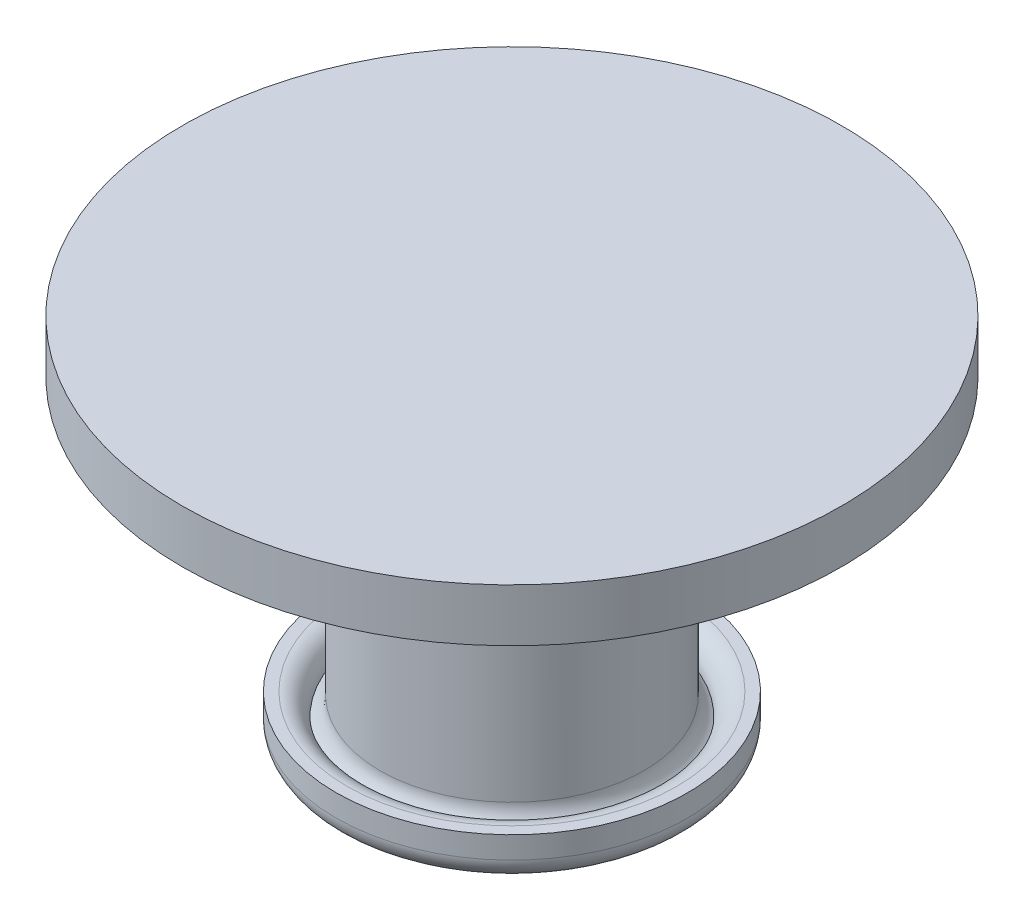
from build123d import *

# Parameters (mm, degrees)
ESBO_O1_R                = 7.5
RESSALTO_EXTRUS_O1_DEPTH = 1.2
ESBO_O2_R                = 3
RESSALTO_EXTRUS_O2_DEPTH = 7.2
ESBO_O3_R                = 4
RESSALTO_EXTRUS_O3_DEPTH = 1
ESBO_O4_R                = 3.25
ESBO_O4_R_2              = 3.0000000000000004
CORTE_EXTRUS_O1_DEPTH    = 0.5
ESBO_O5_R                = 2.5
CORTE_EXTRUS_O4_DEPTH    = 1
FILETE1_R                = 0.5


with BuildPart() as part:
    # Esboço1 → Ressalto-extrusão1 (new body)
    with BuildSketch(Plane(origin=(0, 0, 0), x_dir=(1, 0, 0), z_dir=(0, 1, 0))):
        with Locations(Location((0, 0, 0), (0, 0, 270))):
            Circle(ESBO_O1_R)
    extrude(amount=RESSALTO_EXTRUS_O1_DEPTH)

    # Esboço2 → Ressalto-extrusão2 (add)
    with BuildSketch(Plane.XZ):
        with Locations(Location((0, 0, 0), (0, 0, 90))):
            Circle(ESBO_O2_R)
    extrude(amount=RESSALTO_EXTRUS_O2_DEPTH)

    # Esboço3 → Ressalto-extrusão3 (add)
    with BuildSketch(Plane.XZ.offset(7.2)):
        with Locations(Location((0, 0, 0), (0, 0, 270))):
            Circle(ESBO_O3_R)
    extrude(amount=-RESSALTO_EXTRUS_O3_DEPTH)

    # Esboço4 → Corte-extrusão1 (cut)
    with BuildSketch(Plane(origin=(0, -6.2, 0), x_dir=(1, 0, 0), z_dir=(0, 1, 0))):
        with Locations(Location((0, 0, 0), (0, 0, 270))):
            Circle(ESBO_O4_R)
        with Locations(Location((0, 0, 0), (0, 0, 270))):
            Circle(ESBO_O4_R_2, mode=Mode.SUBTRACT)
    extrude(amount=-CORTE_EXTRUS_O1_DEPTH, mode=Mode.SUBTRACT)

    # Esboço5 → Corte-extrusão4 (cut)
    with BuildSketch(Plane.XZ.offset(7.2)):
        with Locations(Location((0, 0, 0), (0, 0, 270))):
            Circle(ESBO_O5_R)
    extrude(amount=-CORTE_EXTRUS_O4_DEPTH, mode=Mode.SUBTRACT)

    # Filete1
    # the kernel refuses this fillet: 0.5 mm, written as the material it adds along each edge
    with BuildSketch(Plane(origin=(0, -6.7, 0), x_dir=(-1.8e-16, 0, 1), z_dir=(-1, 0, -1.8e-16))) as filete1_piece_1:
        with BuildLine():
            CenterArc((3.5000000000000004, 0.4330127018922436), FILETE1_R, 180, 60.000000000001364)
            Line((3.2500000000000107, 1.865e-14), (3.0000000000000004, 0))
            Line((3.0000000000000004, 0), (3.0000000000000004, 0.4330127018922436))
        make_face()
    revolve(axis=Axis((0, -6.7, 0), (0, 1, 0)))
    with BuildSketch(Plane(origin=(0, -6.2, 0), x_dir=(-1.8e-16, 0, -1), z_dir=(-1, 0, 1.8e-16))) as filete1_piece_2:
        with BuildLine():
            CenterArc((2.5 - FILETE1_R, FILETE1_R), FILETE1_R, 270, 90)
            Line((2.5 - FILETE1_R, 0), (2.5, 0))
            Line((2.5, 0), (2.5, FILETE1_R))
        make_face()
    revolve(axis=Axis((0, -6.2, 0), (0, -1, 0)))
    # the kernel refuses this fillet: 0.5 mm, written as the material it takes off along each edge
    with BuildSketch(Plane(origin=(0, -7.2, 0), x_dir=(-1.8e-16, 0, -1), z_dir=(-1, 0, 1.8e-16))) as filete1_2_piece_1:
        with BuildLine():
            CenterArc((4 - FILETE1_R, -FILETE1_R), FILETE1_R, 0, 90)
            Line((4 - FILETE1_R, 0), (4, 0))
            Line((4, 0), (4, -FILETE1_R))
        make_face()
    revolve(axis=Axis((0, -7.2, 0), (0, -1, 0)), mode=Mode.SUBTRACT)
    with BuildSketch(Plane(origin=(0, -6.2, 0), x_dir=(-1.8e-16, 0, 1), z_dir=(-1, 0, -1.8e-16))) as filete1_2_piece_2:
        with BuildLine():
            CenterArc((3.25 + FILETE1_R, -FILETE1_R), FILETE1_R, 90, 90)
            Line((3.25 + FILETE1_R, 0), (3.25, 0))
            Line((3.25, 0), (3.25, -FILETE1_R))
        make_face()
    revolve(axis=Axis((0, -6.2, 0), (0, 1, 0)), mode=Mode.SUBTRACT)
    with BuildSketch(Plane(origin=(0, -7.2, 0), x_dir=(-1.8e-16, 0, -1), z_dir=(-1, 0, 1.8e-16))) as filete1_2_piece_3:
        with BuildLine():
            CenterArc((2.5 + FILETE1_R, -FILETE1_R), FILETE1_R, 90, 90)
            Line((2.5, -FILETE1_R), (2.5, 0))
            Line((2.5, 0), (2.5 + FILETE1_R, 0))
        make_face()
    revolve(axis=Axis((0, -7.2, 0), (0, -1, 0)), mode=Mode.SUBTRACT)


solid = part.part
